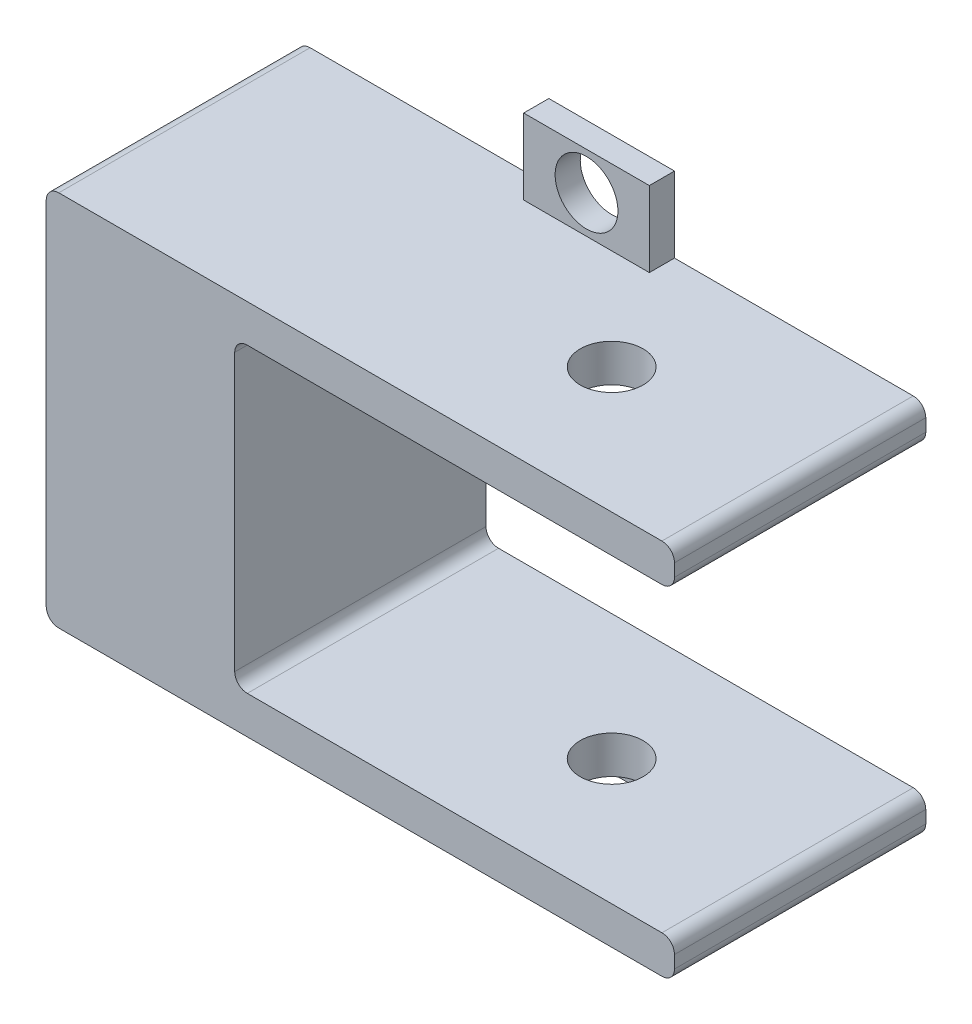
from build123d import *

# Parameters (mm, degrees)
SKETCH1_W           = 63.5
SKETCH1_H           = 38.1
BOSS_EXTRUDE1_DEPTH = 25.4
SKETCH3_W           = 44.45
SKETCH3_H           = 30.48
CUT_EXTRUDE1_DEPTH  = 38.1
SKETCH5_R           = 3.175
CUT_EXTRUDE2_DEPTH  = 76.2
FILLET3_R           = 1.27
SKETCH10_W          = 12.7
SKETCH10_H          = 2.54
BOSS_EXTRUDE4_DEPTH = 7.62
SKETCH11_W          = 12.7
SKETCH11_H          = 2.54
BOSS_EXTRUDE5_DEPTH = 7.62
CUT_EXTRUDE5_REACH  = 83.518
SKETCH12_R          = 3.175


with BuildPart() as part:
    # Sketch1 → Boss-Extrude1 (new body)
    with BuildSketch(Plane.XY):
        with Locations((31.75, 19.05)):
            Rectangle(SKETCH1_W, SKETCH1_H)
    extrude(amount=BOSS_EXTRUDE1_DEPTH)

    # Sketch3 → Cut-Extrude1 (cut)
    with BuildSketch(Plane(origin=(0, 0, 0), x_dir=(-1, 0, 0), z_dir=(0, 0, -1))):
        with Locations((-41.275, 19.05)):
            Rectangle(SKETCH3_W, SKETCH3_H)
    extrude(amount=-CUT_EXTRUDE1_DEPTH, mode=Mode.SUBTRACT)

    # Sketch5 → Cut-Extrude2 (cut)
    with BuildSketch(Plane.XZ):
        with Locations((44.45, 12.7)):
            Circle(SKETCH5_R)
    extrude(amount=-CUT_EXTRUDE2_DEPTH, mode=Mode.SUBTRACT)

    # Fillet3
    fillet3_edges = [part.edges().sort_by_distance(p)[0] for p in [
        (0, 38.1, 12.7),
        (0, 0, 12.7),
        (19.05, 3.81, 12.7),
        (19.05, 34.29, 12.7),
        (63.5, 3.81, 12.7),
        (63.5, 38.1, 12.7),
        (63.5, 34.29, 12.7),
        (63.5, 0, 12.7),
    ]]
    fillet(fillet3_edges, radius=FILLET3_R)

    # Sketch10 → Boss-Extrude4 (add)
    with BuildSketch(Plane.XZ):
        with Locations((31.75, 1.27)):
            Rectangle(SKETCH10_W, SKETCH10_H)
    extrude(amount=BOSS_EXTRUDE4_DEPTH)

    # Sketch11 → Boss-Extrude5 (add)
    with BuildSketch(Plane(origin=(0, 38.1, 0), x_dir=(1, 0, 0), z_dir=(0, 1, 0))):
        with Locations((31.75, -1.27)):
            Rectangle(SKETCH11_W, SKETCH11_H)
    extrude(amount=BOSS_EXTRUDE5_DEPTH)

    # Sketch12 → Cut-Extrude5 (cut, up to next)
    with BuildSketch(Plane.XY.offset(2.54), mode=Mode.PRIVATE) as cut_extrude5_sk1:
        with Locations((31.75, 41.91)):
            Circle(SKETCH12_R)
    cut_extrude5_tool1 = extrude(cut_extrude5_sk1.sketch, amount=-CUT_EXTRUDE5_REACH, mode=Mode.PRIVATE) & part.part
    # Sketch12 → Cut-Extrude5 (cut, up to next)
    with BuildSketch(Plane.XY.offset(2.54), mode=Mode.PRIVATE) as cut_extrude5_sk2:
        with Locations((31.75, -3.81)):
            Circle(SKETCH12_R)
    cut_extrude5_tool2 = extrude(cut_extrude5_sk2.sketch, amount=-CUT_EXTRUDE5_REACH, mode=Mode.PRIVATE) & part.part
    add(cut_extrude5_tool1.solids().sort_by_distance((31.75, 41.91, 2.54))[0], mode=Mode.SUBTRACT)
    add(cut_extrude5_tool2.solids().sort_by_distance((31.75, -3.81, 2.54))[0], mode=Mode.SUBTRACT)


solid = part.part
